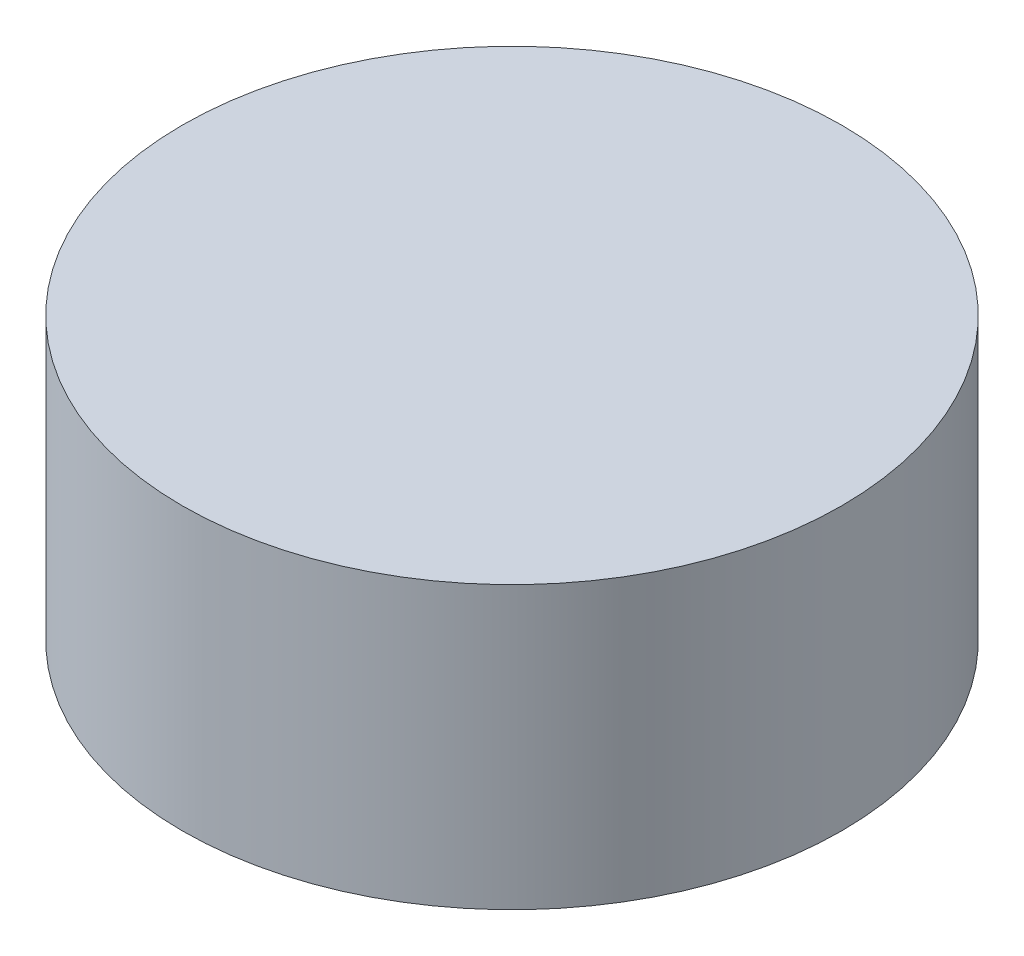
from build123d import *

# Parameters (mm, degrees)
SKETCH1_R           = 44.5
BOSS_EXTRUDE1_DEPTH = 38


with BuildPart() as part:
    # Sketch1 → Boss-Extrude1 (new body)
    with BuildSketch(Plane(origin=(0, 0, 0), x_dir=(1, 0, 0), z_dir=(0, 1, 0))):
        Circle(SKETCH1_R)
    extrude(amount=BOSS_EXTRUDE1_DEPTH)


solid = part.part
